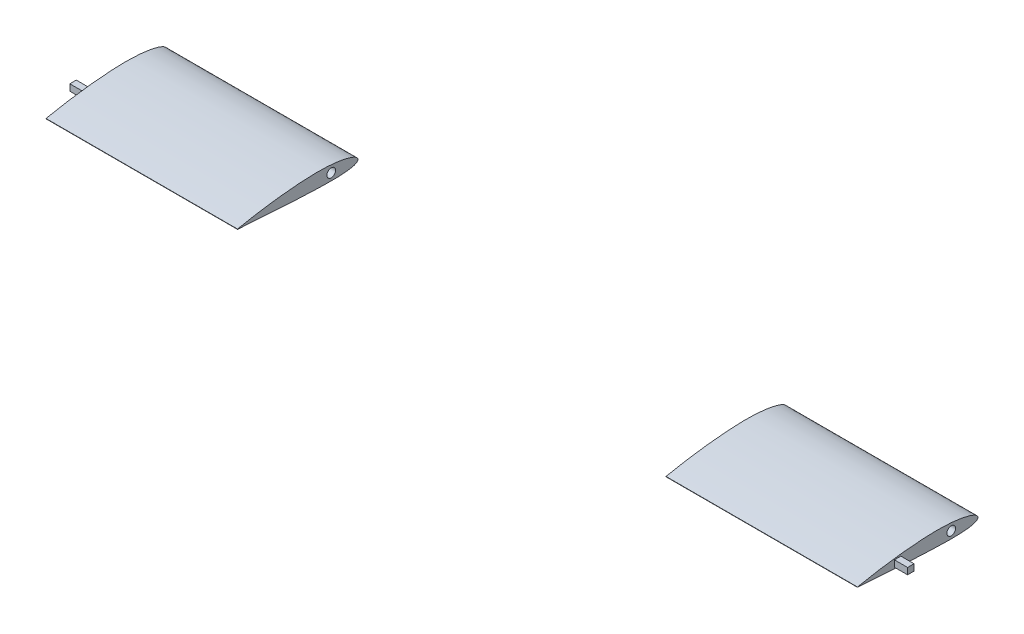
from build123d import *

# Parameters (mm, degrees)
EXTERIOR_DEPTH          = 90
BOSS_EXTRUDE1_DEPTH     = 15
CUT_EXTRUDE1_DEPTH      = 187.882316063
BOSS_EXTRUDE2_DEPTH     = 143
CUT_EXTRUDE6_DEPTH      = 187.015325322
CUT_EXTRUDE2_DEPTH      = 172.341849716
CUT_EXTRUDE2_DEPTH_BACK = 172.341849716
SKETCH13_R              = 3.25
SKETCH19_W              = 4.8
SKETCH19_H              = 4.8
BOSS_EXTRUDE3_DEPTH     = 9.8


with BuildPart() as part:
    # Sketch4 → Exterior (new body)
    with BuildSketch(Plane.XY):
        with BuildLine():
            Line((-30.310889132, 17.5), (30.310889132, 17.5))
            ThreePointArc((30.310889132, 17.5), (0, 35), (-30.310889132, 17.5))
        make_face()
    extrude(amount=EXTERIOR_DEPTH)

    # Sketch5 → Boss-Extrude1 (add)
    with BuildSketch(Plane(origin=(0, 0, 0), x_dir=(-1, 0, 0), z_dir=(0, 0, -1))):
        with BuildLine():
            Line((23.12466216, 17.5), (-23.12466216, 17.5))
            ThreePointArc((-23.12466216, 17.5), (0, 29), (23.12466216, 17.5))
        make_face()
    extrude(amount=BOSS_EXTRUDE1_DEPTH)

    # Sketch8 → Loft9 section 0
    with BuildSketch(Plane(origin=(80, 0, 0), x_dir=(0, 0, -1), z_dir=(1, 0, 0))):
        with BuildLine():
            Line((-90, 21.432366243), (-90, 21.198382159))
            add(Edge.make_bspline(
                [(-90, 21.432366243), (-88.500933926, 21.739545374), (-85.506738957, 22.353096852), (-79.513207025, 23.476900974), (-72.017254902, 24.722076868), (-63.016159498, 26.010803551), (-54.016548901, 27.085553985), (-45.013036623, 27.872502339), (-36.011574753, 28.405421098), (-28.501382509, 28.495628322), (-22.499148056, 28.247142418), (-17.99379134, 27.883038763), (-13.482746661, 27.306456938), (-9.728435841, 26.596441021), (-6.735425578, 25.793161808), (-4.466301103, 25.062862179), (-2.543789771, 24.211953422), (-0.885448876, 23.18032068), (0.560680661, 21.396258105), (-0.941462624, 19.828099306), (-2.568784612, 19.112875936), (-4.482837902, 18.569587924), (-6.74449179, 18.180048952), (-9.749480667, 17.847620831), (-13.500436316, 17.59175521), (-18.004367236, 17.489171146), (-22.5050837, 17.50346658), (-28.505231535, 17.63591039), (-36.00611648, 17.874235378), (-45.006065516, 18.288993082), (-54.003404842, 18.828075055), (-63.002270201, 19.388407607), (-72.00267421, 19.955585158), (-79.500543105, 20.477953196), (-85.500687681, 20.880865225), (-88.500160566, 21.092538335), (-90, 21.198382159)],
                knots=[0, 0, 0, 0, 0.02501249, 0.049959286, 0.099672925, 0.14920632, 0.198581097, 0.24780517, 0.296916575, 0.345952722, 0.370491626, 0.395091204, 0.419814796, 0.444798575, 0.457489819, 0.470406405, 0.483879409, 0.49126412, 0.503458853, 0.513609129, 0.520450991, 0.533235388, 0.545691039, 0.558031884, 0.582609167, 0.607134742, 0.63165208, 0.656174272, 0.705233949, 0.754320379, 0.803437364, 0.852566096, 0.901700994, 0.950848809, 0.975422717, 1, 1, 1, 1], degree=3))
        make_face()
    # Sketch9 → Loft9 section 1
    with BuildSketch(Plane(origin=(-80, 0, 0), x_dir=(0, 0, -1), z_dir=(1, 0, 0))):
        with BuildLine():
            Line((-90, 21.432366243), (-90, 21.198382159))
            add(Edge.make_bspline(
                [(-90, 21.432366243), (-88.500933926, 21.739545374), (-85.506738957, 22.353096852), (-79.513207025, 23.476900974), (-72.017254902, 24.722076868), (-63.016159498, 26.010803551), (-54.016548901, 27.085553985), (-45.013036623, 27.872502339), (-36.011574753, 28.405421098), (-28.501382509, 28.495628322), (-22.499148056, 28.247142418), (-17.99379134, 27.883038763), (-13.482746661, 27.306456938), (-9.728435841, 26.596441021), (-6.735425578, 25.793161808), (-4.466301103, 25.062862179), (-2.543789771, 24.211953422), (-0.885448876, 23.18032068), (0.560680661, 21.396258105), (-0.941462624, 19.828099306), (-2.568784612, 19.112875936), (-4.482837902, 18.569587924), (-6.74449179, 18.180048952), (-9.749480667, 17.847620831), (-13.500436316, 17.59175521), (-18.004367236, 17.489171146), (-22.5050837, 17.50346658), (-28.505231535, 17.63591039), (-36.00611648, 17.874235378), (-45.006065516, 18.288993082), (-54.003404842, 18.828075055), (-63.002270201, 19.388407607), (-72.00267421, 19.955585158), (-79.500543105, 20.477953196), (-85.500687681, 20.880865225), (-88.500160566, 21.092538335), (-90, 21.198382159)],
                knots=[0, 0, 0, 0, 0.02501249, 0.049959286, 0.099672925, 0.14920632, 0.198581097, 0.24780517, 0.296916575, 0.345952722, 0.370491626, 0.395091204, 0.419814796, 0.444798575, 0.457489819, 0.470406405, 0.483879409, 0.49126412, 0.503458853, 0.513609129, 0.520450991, 0.533235388, 0.545691039, 0.558031884, 0.582609167, 0.607134742, 0.63165208, 0.656174272, 0.705233949, 0.754320379, 0.803437364, 0.852566096, 0.901700994, 0.950848809, 0.975422717, 1, 1, 1, 1], degree=3))
        make_face()
    loft()

    # Sketch12 → Cut-Extrude1 (cut, through all)
    with BuildSketch(Plane(origin=(80, 0, 0), x_dir=(0, 0, -1), z_dir=(1, 0, 0))):
        with BuildLine():
            add(Edge.make_bspline(
                [(-90, 21.432366243), (-88.517970234, 21.737980939), (-85.557803137, 22.348407657), (-79.632256681, 23.467116444), (-72.221134443, 24.707701375), (-63.321647609, 25.993209562), (-54.423365173, 27.067117347), (-45.520869444, 27.856425887), (-37.923196081, 28.315745298), (-33.290343793, 28.425153226), (-31.628845216, 28.436220013)],
                knots=[0, 0, 0, 0, 0.02501249, 0.049959286, 0.099672925, 0.14920632, 0.198581097, 0.24780517, 0.296916575, 0.324376959, 0.324376959, 0.324376959, 0.324376959], degree=3))
            add(Edge.make_bspline(
                [(-90, 21.432366243), (-88.500933926, 21.739545374), (-85.506738957, 22.353096852), (-79.513207025, 23.476900974), (-72.017254902, 24.722076868), (-63.016159498, 26.010803551), (-54.016548901, 27.085553985), (-45.013036623, 27.872502339), (-37.550589404, 28.314305923), (-33.087456779, 28.421897917), (-31.628845216, 28.436220013)],
                knots=[0, 0, 0, 0, 0.02501249, 0.049959286, 0.099672925, 0.14920632, 0.198581097, 0.24780517, 0.296916575, 0.320756027, 0.320756027, 0.320756027, 0.320756027], degree=3))
        make_face()
        with BuildLine():
            Line((-97.240851338, 26.906548897), (-90, 21.432366243))
            add(Edge.make_bspline(
                [(-90, 21.432366243), (-88.517970234, 21.737980939), (-85.557803137, 22.348407657), (-79.632256681, 23.467116444), (-72.221134443, 24.707701375), (-63.321647609, 25.993209562), (-54.423365173, 27.067117347), (-45.520869444, 27.856425887), (-37.923196081, 28.315745298), (-33.290343793, 28.425153226), (-31.628845216, 28.436220013)],
                knots=[0, 0, 0, 0, 0.02501249, 0.049959286, 0.099672925, 0.14920632, 0.198581097, 0.24780517, 0.296916575, 0.324376959, 0.324376959, 0.324376959, 0.324376959], degree=3))
            Line((-31.628845216, 28.436220013), (-0.011306323, 30.013384743))
            Line((-0.011306323, 30.013384743), (6.418630162, 38.518437853))
            Line((6.418630162, 38.518437853), (-30.113825381, 44.023328414))
            Line((-30.113825381, 44.023328414), (-90.292288108, 42.772216923))
            Line((-90.292288108, 42.772216923), (-97.240851338, 26.906548897))
        make_face()
    extrude(amount=-CUT_EXTRUDE1_DEPTH, mode=Mode.SUBTRACT)

    # Sketch17 → Boss-Extrude2 (add)
    with BuildSketch(Plane.ZY.offset(80)):
        with BuildLine():
            Line((90, 21.432366243), (90, 21.198382159))
            add(Edge.make_bspline(
                [(90, 21.432366243), (88.500933926, 21.739545374), (85.506738957, 22.353096852), (79.513207025, 23.476900974), (72.017254902, 24.722076868), (63.016159498, 26.010803551), (54.016548901, 27.085553985), (45.013036623, 27.872502339), (36.011574753, 28.405421098), (28.501382509, 28.495628322), (22.499148056, 28.247142418), (17.99379134, 27.883038763), (13.482746661, 27.306456938), (9.728435841, 26.596441021), (6.735425578, 25.793161808), (4.466301103, 25.062862179), (2.543789771, 24.211953422), (0.885448876, 23.18032068), (-0.560680661, 21.396258105), (0.941462624, 19.828099306), (2.568784612, 19.112875936), (4.482837902, 18.569587924), (6.74449179, 18.180048952), (9.749480667, 17.847620831), (13.500436316, 17.59175521), (18.004367236, 17.489171146), (22.5050837, 17.50346658), (28.505231535, 17.63591039), (36.00611648, 17.874235378), (45.006065516, 18.288993082), (54.003404842, 18.828075055), (63.002270201, 19.388407607), (72.00267421, 19.955585158), (79.500543105, 20.477953196), (85.500687681, 20.880865225), (88.500160566, 21.092538335), (90, 21.198382159)],
                knots=[0, 0, 0, 0, 0.02501249, 0.049959286, 0.099672925, 0.14920632, 0.198581097, 0.24780517, 0.296916575, 0.345952722, 0.370491626, 0.395091204, 0.419814796, 0.444798575, 0.457489819, 0.470406405, 0.483879409, 0.49126412, 0.503458853, 0.513609129, 0.520450991, 0.533235388, 0.545691039, 0.558031884, 0.582609167, 0.607134742, 0.63165208, 0.656174272, 0.705233949, 0.754320379, 0.803437364, 0.852566096, 0.901700994, 0.950848809, 0.975422717, 1, 1, 1, 1], degree=3))
        make_face()
    extrude(amount=BOSS_EXTRUDE2_DEPTH)

    # Sketch18 → Cut-Extrude6 (cut, through all)
    with BuildSketch(Plane(origin=(-80, 0, 0), x_dir=(0, 0, -1), z_dir=(1, 0, 0))):
        Polygon((-99.866971184, 5.715372229), (-104.390100049, 63.325750406), (31.898914441, 60.82612656), (39.278756274, -3.211855795), align=None)
    extrude(amount=CUT_EXTRUDE6_DEPTH, mode=Mode.SUBTRACT)

    # Sketch13 → Cut-Extrude2 (cut, two sides: drawn at the far end of the back side and taken through both)
    with BuildSketch(Plane.ZY.offset(80).offset(-CUT_EXTRUDE2_DEPTH_BACK)):
        with Locations((20, 22.7683278)):
            Circle(SKETCH13_R)
    extrude(amount=CUT_EXTRUDE2_DEPTH + CUT_EXTRUDE2_DEPTH_BACK, mode=Mode.SUBTRACT)

    # Sketch19 → Boss-Extrude3 (add)
    with BuildSketch(Plane.ZY.offset(223)):
        with Locations((60, 22.7683278)):
            Rectangle(SKETCH19_W, SKETCH19_H)
    extrude(amount=BOSS_EXTRUDE3_DEPTH)


with BuildPart() as body_2:
    # Mirror3: mirrored copy
    add(part.part.mirror(Plane(origin=(80, 0, 0), x_dir=(0, 0, 1), z_dir=(1, 0, 0))))


solid = Compound([part.part, body_2.part])
